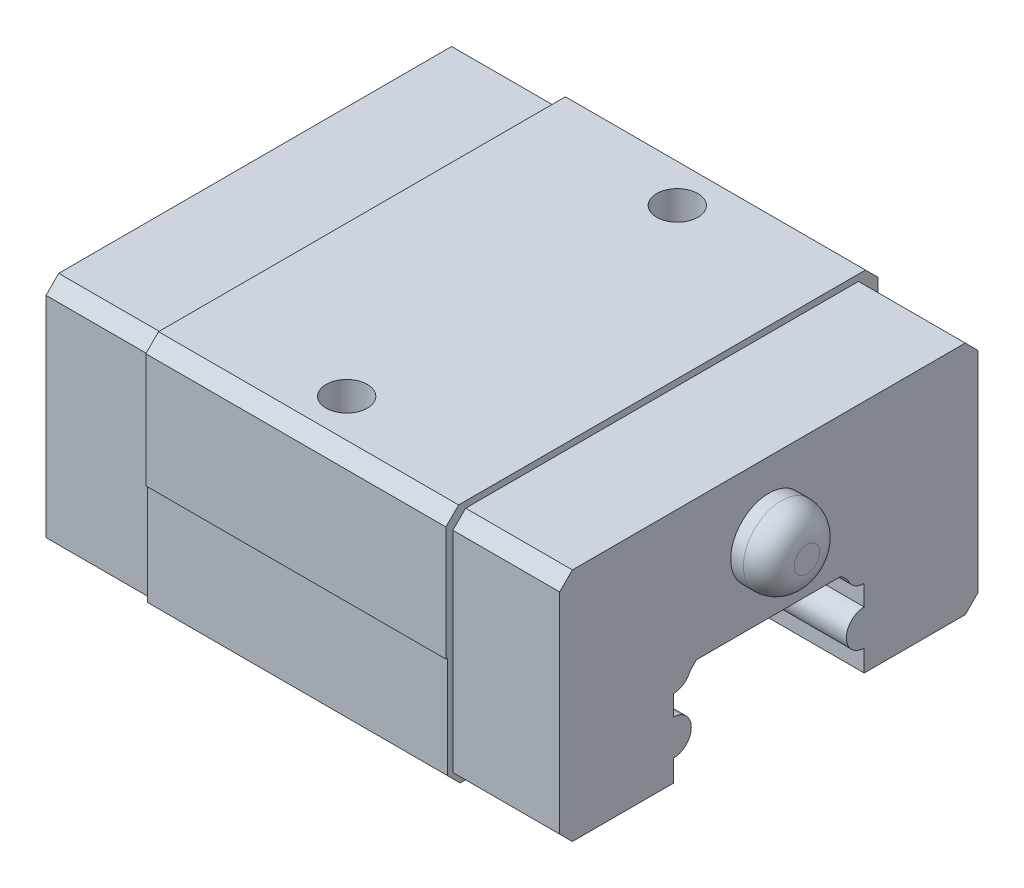
from build123d import *

# Parameters (mm, degrees)
SKETCH1_W               = 34
SKETCH1_H               = 19
BOSS_EXTRUDE1_DEPTH     = 20.2
SKETCH2_OUTSIDE_W       = 47.224
SKETCH2_OUTSIDE_H       = 32.224
SKETCH2_OUTSIDE_W_2     = 32.9
SKETCH2_OUTSIDE_H_2     = 18.5
CUT_EXTRUDE2_DEPTH      = 44.462627624
CUT_EXTRUDE8_DEPTH      = 36.679686097
CUT_EXTRUDE8_DEPTH_BACK = 36.679686097
SKETCH3_W               = 0.125
SKETCH3_H               = 9
CUT_EXTRUDE3_DEPTH      = 23.6
CHAMFER1_SIZE           = 1
CHAMFER2_SIZE           = 1
CHAMFER3_SIZE           = 1
CHAMFER4_SIZE           = 1
SKETCH10_R              = 3
BOSS_EXTRUDE3_DEPTH     = 3
FILLET1_R               = 2
TAP1_D                  = 3.242
TAP1_DEPTH              = 6
TAP1_TIP                = 0.973995063


with BuildPart() as part:
    # Sketch1 → Boss-Extrude1 (new, symmetric)
    with BuildSketch(Plane(origin=(0, 0, 0), x_dir=(0, 0, -1), z_dir=(1, 0, 0))):
        with Locations((0, 14.5)):
            Rectangle(SKETCH1_W, SKETCH1_H)
    extrude(amount=BOSS_EXTRUDE1_DEPTH, both=True)

    # Sketch2 outside → Cut-Extrude2 (cut, through all)
    with BuildSketch(Plane(origin=(11.8, 0, 0), x_dir=(0, 0, -1), z_dir=(1, 0, 0))):
        with Locations((0, 14.5)):
            Rectangle(SKETCH2_OUTSIDE_W, SKETCH2_OUTSIDE_H)
        with Locations((0, 14.25)):
            Rectangle(SKETCH2_OUTSIDE_W_2, SKETCH2_OUTSIDE_H_2, mode=Mode.SUBTRACT)
    cut_extrude2 = extrude(amount=CUT_EXTRUDE2_DEPTH, mode=Mode.SUBTRACT)

    # Mirror1: Cut-Extrude2 across plane
    add(cut_extrude2.mirror(Plane(origin=(0, 0, 0), x_dir=(0, 0, 1), z_dir=(1, 0, 0))), mode=Mode.SUBTRACT)

    # Sketch5 → Cut-Extrude8 (cut, two sides: drawn at the far end of the back side and taken through both)
    with BuildSketch(Plane(origin=(0, 0, 0), x_dir=(0, 0, -1), z_dir=(1, 0, 0)).offset(-CUT_EXTRUDE8_DEPTH_BACK)):
        with BuildLine():
            Line((-5.692330317, 12.5), (5.692330317, 12.5))
            Line((5.692330317, 12.5), (6.192330317, 12))
            ThreePointArc((6.192330317, 12), (6.706274607, 11.346743741), (7.5, 11.1))
            Line((7.5, 11.1), (7.5, 9.5))
            ThreePointArc((7.5, 9.5), (6.1, 8.1), (7.5, 6.7))
            Line((7.5, 6.7), (7.5, 1))
            Line((7.5, 1), (6.5, 0))
            Line((6.5, 0), (-6.5, 0))
            Line((-6.5, 0), (-7.5, 1))
            Line((-7.5, 1), (-7.5, 6.7))
            ThreePointArc((-7.5, 6.7), (-6.1, 8.1), (-7.5, 9.5))
            Line((-7.5, 9.5), (-7.5, 11.1))
            ThreePointArc((-7.5, 11.1), (-6.706274607, 11.346743741), (-6.192330317, 12))
            Line((-6.192330317, 12), (-5.692330317, 12.5))
        make_face()
    extrude(amount=CUT_EXTRUDE8_DEPTH + CUT_EXTRUDE8_DEPTH_BACK, mode=Mode.SUBTRACT)

    # Sketch3 → Cut-Extrude3 (cut)
    with BuildSketch(Plane(origin=(11.8, 0, 0), x_dir=(0, 0, -1), z_dir=(1, 0, 0))):
        with Locations((-16.9375, 9.5)):
            Rectangle(SKETCH3_W, SKETCH3_H)
    cut_extrude3 = extrude(amount=-CUT_EXTRUDE3_DEPTH, mode=Mode.SUBTRACT)

    # Mirror2: Cut-Extrude3 across plane
    add(cut_extrude3.mirror(Plane.XY), mode=Mode.SUBTRACT)

    # Chamfer1
    chamfer1_edges = [part.edges().sort_by_distance(p)[0] for p in [
        (-16, 23.5, 16.45),
        (-16, 23.5, -16.45),
        (16, 23.5, -16.45),
        (16, 23.5, 16.45),
    ]]
    chamfer(chamfer1_edges, length=CHAMFER1_SIZE)

    # Chamfer2
    chamfer2_edges = [part.edges().sort_by_distance(p)[0] for p in [
        (0, 24, -17),
        (0, 24, 17),
    ]]
    chamfer(chamfer2_edges, length=CHAMFER2_SIZE)

    # Chamfer3
    chamfer3_edges = [part.edges().sort_by_distance(p)[0] for p in [
        (-16, 5, -16.45),
        (16, 5, -16.45),
        (-16, 5, 16.45),
        (16, 5, 16.45),
    ]]
    chamfer(chamfer3_edges, length=CHAMFER3_SIZE)

    # Chamfer4
    chamfer4_edges = [part.edges().sort_by_distance(p)[0] for p in [
        (0, 5, -16.875),
        (0, 5, 16.875),
    ]]
    chamfer(chamfer4_edges, length=CHAMFER4_SIZE)

    # Sketch10 → Boss-Extrude3 (add)
    with BuildSketch(Plane(origin=(20.2, 0, 0), x_dir=(0, 0, -1), z_dir=(1, 0, 0))):
        with Locations((0, 18)):
            Circle(SKETCH10_R)
    extrude(amount=BOSS_EXTRUDE3_DEPTH)

    # Fillet1
    fillet1_edges = [part.edges().sort_by_distance(p)[0] for p in [
        (23.2, 18, 3),
    ]]
    fillet(fillet1_edges, radius=FILLET1_R)

    # Tap1
    with Locations(Plane(origin=(0, 24, 0), x_dir=(1, 0, 0), z_dir=(0, 1, 0))):
        with Locations((0, -13), (0, 13)):
            Hole(TAP1_D / 2, depth=TAP1_DEPTH)
            with Locations((0, 0, -(TAP1_DEPTH + TAP1_TIP / 2))):  # 118° drill point
                Cone(0, TAP1_D / 2, TAP1_TIP, mode=Mode.SUBTRACT)


solid = part.part
